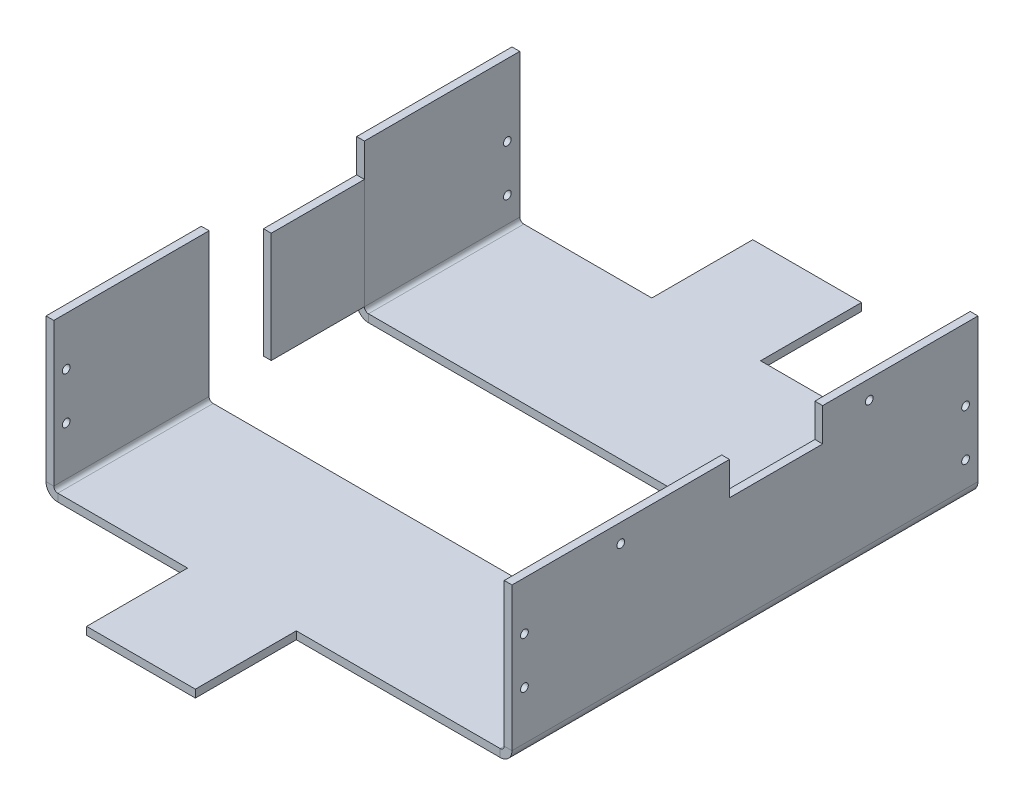
from build123d import *

# Parameters (mm, degrees)
SKETCH1_W                    = 300
SKETCH1_H                    = 300
BASE_FLANGE1_DEPTH           = 5
EDGE_FLANGE1_STRIP_W         = 25.2
EDGE_FLANGE1_STRIP_H         = 5
EDGE_FLANGE1_STRIP_CUT_DEPTH = 300
EDGE_FLANGE1_DEPTH           = 300
EDGE_FLANGE1_PROFILE_W       = 300
EDGE_FLANGE1_PROFILE_H       = 92.4
EDGE_FLANGE1_PROFILE_R       = 2.5
EDGE_FLANGE1_FLAT_DEPTH      = 5
SKETCH9_W                    = 200
SKETCH9_H                    = 100
CUT_EXTRUDE1_DEPTH           = 10
SKETCH16_W                   = 70
SKETCH16_H                   = 65
TAB2_DEPTH                   = 5
EDGE_FLANGE3_STRIP_W         = 25.2
EDGE_FLANGE3_STRIP_H         = 5
EDGE_FLANGE3_STRIP_CUT_DEPTH = 100
EDGE_FLANGE3_DEPTH           = 100
EDGE_FLANGE3_PROFILE_W       = 100
EDGE_FLANGE3_PROFILE_H       = 92.4
EDGE_FLANGE3_PROFILE_R       = 2.5
EDGE_FLANGE3_FLAT_DEPTH      = 5
EDGE_FLANGE4_STRIP_W         = 25.2
EDGE_FLANGE4_STRIP_H         = 5
EDGE_FLANGE4_STRIP_CUT_DEPTH = 100
EDGE_FLANGE4_DEPTH           = 100
EDGE_FLANGE4_PROFILE_W       = 100
EDGE_FLANGE4_PROFILE_H       = 92.4
EDGE_FLANGE4_PROFILE_R       = 2.5
EDGE_FLANGE4_FLAT_DEPTH      = 5
SKETCH37_W                   = 5
SKETCH37_H                   = 92.4
BASE_FLANGE2_DEPTH           = 60
CUT_EXTRUDE2_DEPTH           = 5
CUT_EXTRUDE3_START           = -300
SKETCH41_W                   = 60
SKETCH41_H                   = 21.380618099
CUT_EXTRUDE3_DEPTH           = 300


# Sheet-metal steps are written as plain solids
with BuildPart() as part:
    # Sketch1 → Base-Flange1 (new body)
    with BuildSketch(Plane(origin=(0, 0, 0), x_dir=(1, 0, 0), z_dir=(0, 1, 0))):
        Rectangle(SKETCH1_W, SKETCH1_H)
    extrude(amount=-BASE_FLANGE1_DEPTH)

    # Edge-Flange1 strip (across the edge) → Edge-Flange1 strip cut (cut)
    with BuildSketch(Plane(origin=(150, 0, 150), x_dir=(-1, 0, 0), z_dir=(0, 0, -1))):
        with Locations((-5, -2.5)):
            Rectangle(EDGE_FLANGE1_STRIP_W, EDGE_FLANGE1_STRIP_H)
    extrude(amount=EDGE_FLANGE1_STRIP_CUT_DEPTH, mode=Mode.SUBTRACT)

    # Edge-Flange1 bend section (across the edge) → Edge-Flange1 (add)
    with BuildSketch(Plane(origin=(150, 0, 150), x_dir=(-1, 0, 0), z_dir=(0, 0, -1))):
        with BuildLine():
            Line((0, 2.6), (5, 2.6))
            ThreePointArc((5, 2.6), (5.761522369, 0.761522369), (7.6, 0))
            Line((7.6, 0), (7.6, -5))
            ThreePointArc((7.6, -5), (2.225988463, -2.774011537), (0, 2.6))
        make_face()
    extrude(amount=EDGE_FLANGE1_DEPTH)

    # Edge-Flange1 profile (on flange) → Edge-Flange1 flat (add)
    with BuildSketch(Plane(origin=(150, 0, 0), x_dir=(0, 0, -1), z_dir=(1, 0, 0))):
        with Locations((0, 48.8)):
            Rectangle(EDGE_FLANGE1_PROFILE_W, EDGE_FLANGE1_PROFILE_H)
        with Locations((-142, 33.8)):
            Circle(EDGE_FLANGE1_PROFILE_R, mode=Mode.SUBTRACT)
        with Locations((142, 18.8)):
            Circle(EDGE_FLANGE1_PROFILE_R, mode=Mode.SUBTRACT)
        with Locations((142, 48.8)):
            Circle(EDGE_FLANGE1_PROFILE_R, mode=Mode.SUBTRACT)
        with Locations((-142, 63.8)):
            Circle(EDGE_FLANGE1_PROFILE_R, mode=Mode.SUBTRACT)
        with Locations((-80, 83)):
            Circle(EDGE_FLANGE1_PROFILE_R, mode=Mode.SUBTRACT)
        with Locations((80, 83)):
            Circle(EDGE_FLANGE1_PROFILE_R, mode=Mode.SUBTRACT)
    extrude(amount=-EDGE_FLANGE1_FLAT_DEPTH)

    # Sketch9 → Cut-Extrude1 (cut)
    with BuildSketch(Plane(origin=(0, 0, 0), x_dir=(1, 0, 0), z_dir=(0, 1, 0))):
        with Locations((-50, 0)):
            Rectangle(SKETCH9_W, SKETCH9_H)
    extrude(amount=-CUT_EXTRUDE1_DEPTH, mode=Mode.SUBTRACT)

    # Sketch16 → Tab2 (add)
    with BuildSketch(Plane(origin=(0, 0, 0), x_dir=(1, 0, 0), z_dir=(0, 1, 0))):
        with Locations((-25, 182.5)):
            Rectangle(SKETCH16_W, SKETCH16_H)
        with Locations((-23.848827091, -182.5)):
            Rectangle(SKETCH16_W, SKETCH16_H)
    extrude(amount=-TAB2_DEPTH)

    # Edge-Flange3 strip (across the edge) → Edge-Flange3 strip cut (cut)
    with BuildSketch(Plane(origin=(-150, 0, 50), x_dir=(1, 0, 0), z_dir=(0, 0, 1))):
        with Locations((-5, -2.5)):
            Rectangle(EDGE_FLANGE3_STRIP_W, EDGE_FLANGE3_STRIP_H)
    extrude(amount=EDGE_FLANGE3_STRIP_CUT_DEPTH, mode=Mode.SUBTRACT)

    # Edge-Flange3 bend section (across the edge) → Edge-Flange3 (add)
    with BuildSketch(Plane(origin=(-150, 0, 50), x_dir=(1, 0, 0), z_dir=(0, 0, 1))):
        with BuildLine():
            Line((0, 2.6), (5, 2.6))
            ThreePointArc((5, 2.6), (5.761522369, 0.761522369), (7.6, 0))
            Line((7.6, 0), (7.6, -5))
            ThreePointArc((7.6, -5), (2.225988463, -2.774011537), (0, 2.6))
        make_face()
    extrude(amount=EDGE_FLANGE3_DEPTH)

    # Edge-Flange3 profile (on flange) → Edge-Flange3 flat (add)
    with BuildSketch(Plane.ZY.offset(150)):
        with Locations((100, 48.8)):
            Rectangle(EDGE_FLANGE3_PROFILE_W, EDGE_FLANGE3_PROFILE_H)
        with Locations((142, 33.8)):
            Circle(EDGE_FLANGE3_PROFILE_R, mode=Mode.SUBTRACT)
        with Locations((142, 63.8)):
            Circle(EDGE_FLANGE3_PROFILE_R, mode=Mode.SUBTRACT)
    extrude(amount=-EDGE_FLANGE3_FLAT_DEPTH)

    # Edge-Flange4 strip (across the edge) → Edge-Flange4 strip cut (cut)
    with BuildSketch(Plane(origin=(-150, 0, -150), x_dir=(1, 0, 0), z_dir=(0, 0, 1))):
        with Locations((-5, -2.5)):
            Rectangle(EDGE_FLANGE4_STRIP_W, EDGE_FLANGE4_STRIP_H)
    extrude(amount=EDGE_FLANGE4_STRIP_CUT_DEPTH, mode=Mode.SUBTRACT)

    # Edge-Flange4 bend section (across the edge) → Edge-Flange4 (add)
    with BuildSketch(Plane(origin=(-150, 0, -150), x_dir=(1, 0, 0), z_dir=(0, 0, 1))):
        with BuildLine():
            Line((0, 2.6), (5, 2.6))
            ThreePointArc((5, 2.6), (5.761522369, 0.761522369), (7.6, 0))
            Line((7.6, 0), (7.6, -5))
            ThreePointArc((7.6, -5), (2.225988463, -2.774011537), (0, 2.6))
        make_face()
    extrude(amount=EDGE_FLANGE4_DEPTH)

    # Edge-Flange4 profile (on flange) → Edge-Flange4 flat (add)
    with BuildSketch(Plane.ZY.offset(150)):
        with Locations((-100, 48.8)):
            Rectangle(EDGE_FLANGE4_PROFILE_W, EDGE_FLANGE4_PROFILE_H)
        with Locations((-142, 18.8)):
            Circle(EDGE_FLANGE4_PROFILE_R, mode=Mode.SUBTRACT)
        with Locations((-142, 48.8)):
            Circle(EDGE_FLANGE4_PROFILE_R, mode=Mode.SUBTRACT)
    extrude(amount=-EDGE_FLANGE4_FLAT_DEPTH)


with BuildPart() as body_2:
    # Sketch37 → Base-Flange2 (new body)
    with BuildSketch(Plane.XY.offset(-50)):
        with Locations((-147.5, 48.8)):
            Rectangle(SKETCH37_W, SKETCH37_H)
    extrude(amount=BASE_FLANGE2_DEPTH)

    # Sketch40 → Cut-Extrude2 (cut)
    with BuildSketch(Plane.ZY.offset(150)):
        with BuildLine():
            Line((-20, 95), (0, 95))
            ThreePointArc((0, 95), (-10, 85), (-20, 95))
        make_face()
    extrude(amount=-CUT_EXTRUDE2_DEPTH, mode=Mode.SUBTRACT)


with BuildPart() as cut_extrude3_tool:
    # Sketch41 → Cut-Extrude3 (new body)
    with BuildSketch(Plane.ZY.offset(150).offset(CUT_EXTRUDE3_START)):
        with Locations((-20, 84.30969095)):
            Rectangle(SKETCH41_W, SKETCH41_H)
    extrude(amount=CUT_EXTRUDE3_DEPTH)


with BuildPart() as part_1:
    add(part.part)

    # Cut-Extrude3: cut by cut_extrude3_tool
    add(cut_extrude3_tool.part, mode=Mode.SUBTRACT)


with BuildPart() as body_2_1:
    add(body_2.part)

    # Cut-Extrude3: cut by cut_extrude3_tool
    add(cut_extrude3_tool.part, mode=Mode.SUBTRACT)


solid = Compound([part_1.part, body_2_1.part])
